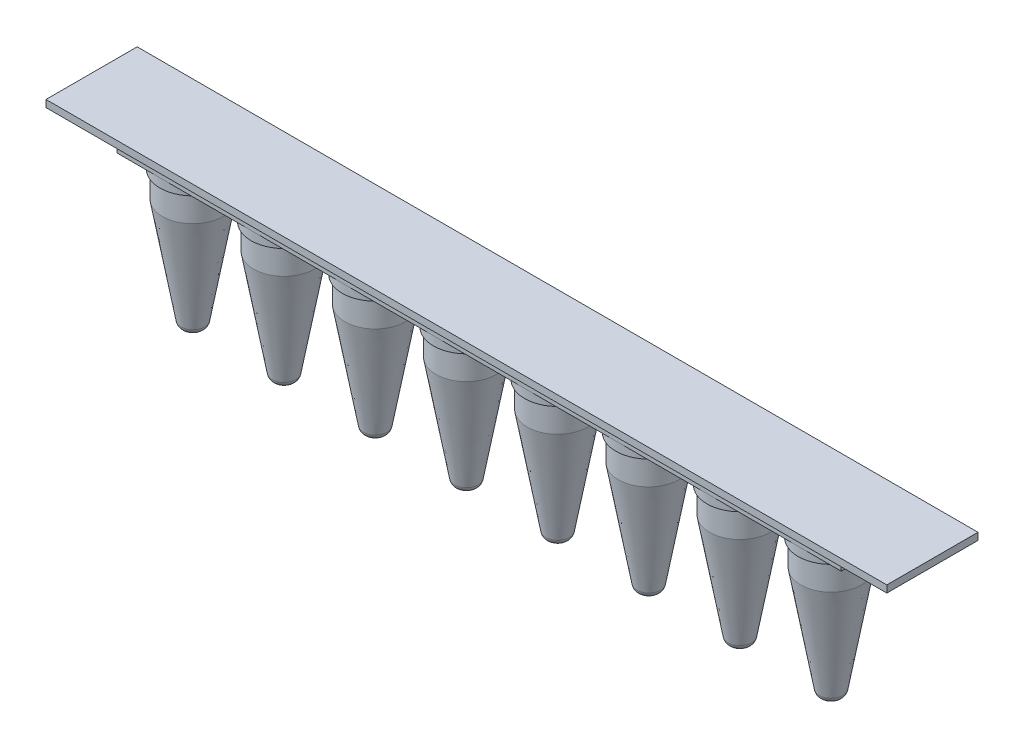
from build123d import *

# Parameters (mm, degrees)
SKETCH2_R           = 3
BOSS_EXTRUDE1_DEPTH = 16
CHAMFER1_SIZE       = 1.9304
CHAMFER1_SIZE2      = 10.947842425
FILLET2_R           = 0.7112
SKETCH3_R           = 3.25
BOSS_EXTRUDE2_DEPTH = 2.5
SKETCH4_W           = 71.5000084
SKETCH4_H           = 6.5
BOSS_EXTRUDE3_DEPTH = 0.75
LPATTERN1_START     = 15.124999972
LPATTERN1_OUTLINE_R = 3.25
LPATTERN1_DEPTH     = 0.875000028
SKETCH5_W           = 83
SKETCH5_H           = 9
BOSS_EXTRUDE4_DEPTH = 0.7


# Read off the part's stored shape, not the designer's step: LPattern1
with BuildPart() as part:
    # Sketch2 → Boss-Extrude1 (new body)
    with BuildSketch(Plane(origin=(0, 0, 0), x_dir=(1, 0, 0), z_dir=(0, 1, 0))):
        with Locations(Location((0, 0, 0), (0, 0, 270))):
            Circle(SKETCH2_R)
    extrude(amount=BOSS_EXTRUDE1_DEPTH)

    # Chamfer1
    chamfer1_edges = [part.edges().sort_by_distance(p)[0] for p in [
        (0, 0, -3),
    ]]
    chamfer1_side = [part.faces().sort_by_distance(p)[0] for p in [
        (0, 0, 0),
    ]]
    chamfer(chamfer1_edges, length=CHAMFER1_SIZE, length2=CHAMFER1_SIZE2, reference=chamfer1_side[0])

    # Fillet2
    fillet2_edges = [part.edges().sort_by_distance(p)[0] for p in [
        (0, 0, -1.0696),
    ]]
    fillet(fillet2_edges, radius=FILLET2_R)

    # Sketch3 → Boss-Extrude2 (add)
    with BuildSketch(Plane(origin=(0, 16, 0), x_dir=(1, 0, 0), z_dir=(0, 1, 0))):
        with Locations(Location((0, 0, 0), (0, 0, 270))):
            Circle(SKETCH3_R)
    extrude(amount=-BOSS_EXTRUDE2_DEPTH)

    # Sketch4 → Boss-Extrude3 (add)
    with BuildSketch(Plane(origin=(0, 15.124999972, 0), x_dir=(1, 0, 0), z_dir=(0, 1, 0))):
        with Locations((-31.5000042, 0)):
            Rectangle(SKETCH4_W, SKETCH4_H)
    extrude(amount=-BOSS_EXTRUDE3_DEPTH)

    # LPattern1 outline → LPattern1 (add)
    with BuildSketch(Plane(origin=(0, 0, 0), x_dir=(1, 0, 0), z_dir=(0, 1, 0)).offset(LPATTERN1_START)):
        with Locations((-9, 0)):
            Circle(LPATTERN1_OUTLINE_R)
        with Locations((-18, 0)):
            Circle(LPATTERN1_OUTLINE_R)
        with Locations((-27, 0)):
            Circle(LPATTERN1_OUTLINE_R)
        with Locations((-36, 0)):
            Circle(LPATTERN1_OUTLINE_R)
        with Locations((-45, 0)):
            Circle(LPATTERN1_OUTLINE_R)
        with Locations((-54, 0)):
            Circle(LPATTERN1_OUTLINE_R)
        with Locations((-63, 0)):
            Circle(LPATTERN1_OUTLINE_R)
    extrude(amount=LPATTERN1_DEPTH)

    # LPattern1 2 outline → LPattern1 2 (revolve)
    with BuildSketch(Plane(origin=(-9, 0, 0), x_dir=(1, 0, 0), z_dir=(0, 0, 1))):
        with BuildLine():
            Line((0, 14.374999972), (0, 0))
            Line((0, 0), (0.472832342, 0))
            ThreePointArc((0.472832342, 0), (0.92998289, 0.166389192), (1.173227616, 0.587701416))
            Line((1.173227616, 0.587701416), (3, 10.947842425))
            Line((3, 10.947842425), (3, 13.5))
            Line((3, 13.5), (3.25, 13.5))
            Line((3.25, 13.5), (3.25, 14.374999972))
            Line((3.25, 14.374999972), (0, 14.374999972))
        make_face()
    revolve(axis=Axis((-9, 0, 0), (0, 1, 0)))

    # LPattern1 3 outline → LPattern1 3 (revolve)
    with BuildSketch(Plane(origin=(-18, 0, 0), x_dir=(1, 0, 0), z_dir=(0, 0, 1))):
        with BuildLine():
            Line((0, 14.374999972), (0, 0))
            Line((0, 0), (0.472832342, 0))
            ThreePointArc((0.472832342, 0), (0.92998289, 0.166389192), (1.173227616, 0.587701416))
            Line((1.173227616, 0.587701416), (3, 10.947842425))
            Line((3, 10.947842425), (3, 13.5))
            Line((3, 13.5), (3.25, 13.5))
            Line((3.25, 13.5), (3.25, 14.374999972))
            Line((3.25, 14.374999972), (0, 14.374999972))
        make_face()
    revolve(axis=Axis((-18, 0, 0), (0, 1, 0)))

    # LPattern1 4 outline → LPattern1 4 (revolve)
    with BuildSketch(Plane(origin=(-27, 0, 0), x_dir=(1, 0, 0), z_dir=(0, 0, 1))):
        with BuildLine():
            Line((0, 14.374999972), (0, 0))
            Line((0, 0), (0.472832342, 0))
            ThreePointArc((0.472832342, 0), (0.92998289, 0.166389192), (1.173227616, 0.587701416))
            Line((1.173227616, 0.587701416), (3, 10.947842425))
            Line((3, 10.947842425), (3, 13.5))
            Line((3, 13.5), (3.25, 13.5))
            Line((3.25, 13.5), (3.25, 14.374999972))
            Line((3.25, 14.374999972), (0, 14.374999972))
        make_face()
    revolve(axis=Axis((-27, 0, 0), (0, 1, 0)))

    # LPattern1 5 outline → LPattern1 5 (revolve)
    with BuildSketch(Plane(origin=(-36, 0, 0), x_dir=(1, 0, 0), z_dir=(0, 0, 1))):
        with BuildLine():
            Line((0, 14.374999972), (0, 0))
            Line((0, 0), (0.472832342, 0))
            ThreePointArc((0.472832342, 0), (0.92998289, 0.166389192), (1.173227616, 0.587701416))
            Line((1.173227616, 0.587701416), (3, 10.947842425))
            Line((3, 10.947842425), (3, 13.5))
            Line((3, 13.5), (3.25, 13.5))
            Line((3.25, 13.5), (3.25, 14.374999972))
            Line((3.25, 14.374999972), (0, 14.374999972))
        make_face()
    revolve(axis=Axis((-36, 0, 0), (0, 1, 0)))

    # LPattern1 6 outline → LPattern1 6 (revolve)
    with BuildSketch(Plane(origin=(-45, 0, 0), x_dir=(1, 0, 0), z_dir=(0, 0, 1))):
        with BuildLine():
            Line((0, 14.374999972), (0, 0))
            Line((0, 0), (0.472832342, 0))
            ThreePointArc((0.472832342, 0), (0.92998289, 0.166389192), (1.173227616, 0.587701416))
            Line((1.173227616, 0.587701416), (3, 10.947842425))
            Line((3, 10.947842425), (3, 13.5))
            Line((3, 13.5), (3.25, 13.5))
            Line((3.25, 13.5), (3.25, 14.374999972))
            Line((3.25, 14.374999972), (0, 14.374999972))
        make_face()
    revolve(axis=Axis((-45, 0, 0), (0, 1, 0)))

    # LPattern1 7 outline → LPattern1 7 (revolve)
    with BuildSketch(Plane(origin=(-54, 0, 0), x_dir=(1, 0, 0), z_dir=(0, 0, 1))):
        with BuildLine():
            Line((0, 14.374999972), (0, 0))
            Line((0, 0), (0.472832342, 0))
            ThreePointArc((0.472832342, 0), (0.92998289, 0.166389192), (1.173227616, 0.587701416))
            Line((1.173227616, 0.587701416), (3, 10.947842425))
            Line((3, 10.947842425), (3, 13.5))
            Line((3, 13.5), (3.25, 13.5))
            Line((3.25, 13.5), (3.25, 14.374999972))
            Line((3.25, 14.374999972), (0, 14.374999972))
        make_face()
    revolve(axis=Axis((-54, 0, 0), (0, 1, 0)))

    # LPattern1 8 outline → LPattern1 8 (revolve)
    with BuildSketch(Plane(origin=(-63, 0, 0), x_dir=(1, 0, 0), z_dir=(0, 0, 1))):
        with BuildLine():
            Line((0, 14.374999972), (0, 0))
            Line((0, 0), (0.472832342, 0))
            ThreePointArc((0.472832342, 0), (0.92998289, 0.166389192), (1.173227616, 0.587701416))
            Line((1.173227616, 0.587701416), (3, 10.947842425))
            Line((3, 10.947842425), (3, 13.5))
            Line((3, 13.5), (3.25, 13.5))
            Line((3.25, 13.5), (3.25, 14.374999972))
            Line((3.25, 14.374999972), (0, 14.374999972))
        make_face()
    revolve(axis=Axis((-63, 0, 0), (0, 1, 0)))

    # Sketch5 → Boss-Extrude4 (add)
    with BuildSketch(Plane(origin=(0, 16, 0), x_dir=(1, 0, 0), z_dir=(0, 1, 0))):
        with Locations((-31.5, 0)):
            Rectangle(SKETCH5_W, SKETCH5_H)
    extrude(amount=BOSS_EXTRUDE4_DEPTH)


solid = part.part
